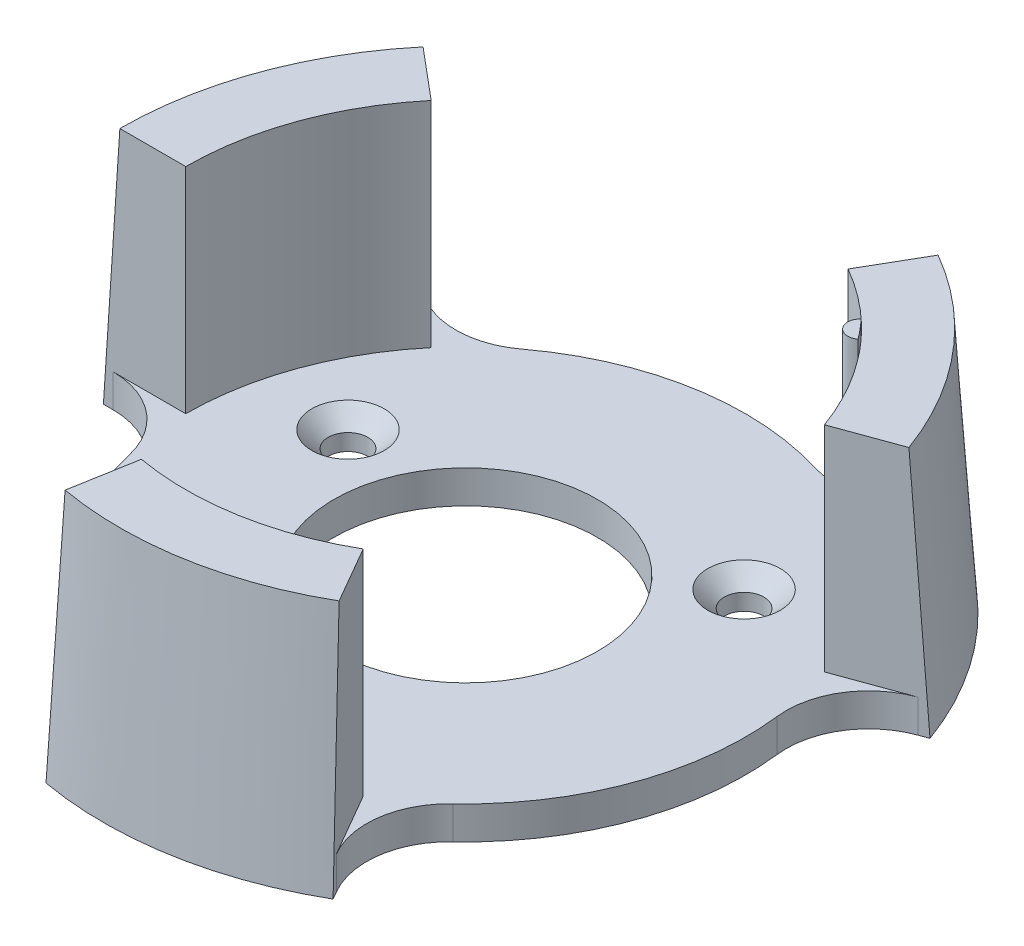
from build123d import *

# Parameters (mm, degrees)
SKETCH1_R                                    = 17
SKETCH1_R_2                                  = 8
BOSS_EXTRUDE4_DEPTH                          = 2
REVOLVE2_ANGLE                               = 40
CIRPATTERN1_COUNT                            = 3
FILLET1_R                                    = 5
CSK_FOR_M2_COUNTERSUNK_FLAT_HEAD_SCR_2_COUNT = 2
CSK_FOR_M2_COUNTERSUNK_FLAT_HEAD_SCR_2_PITCH = 20.784609691
CSK_FOR_M2_COUNTERSUNK_FLAT_HEAD_SCR_3_COUNT = 2
CSK_FOR_M2_COUNTERSUNK_FLAT_HEAD_SCR_3_PITCH = 20.747553677
BOSS_EXTRUDE6_DEPTH                          = 14


with BuildPart() as part:
    # Sketch1 → Boss-Extrude4 (new body)
    with BuildSketch(Plane(origin=(0, 0, 0), x_dir=(1, 0, 0), z_dir=(0, 1, 0))):
        Circle(SKETCH1_R)
        Circle(SKETCH1_R_2, mode=Mode.SUBTRACT)
    extrude(amount=BOSS_EXTRUDE4_DEPTH)

    # Sketch5 → Revolve2 (revolve)
    with BuildSketch(Plane.XY):
        Polygon((-17, 0), (-22, 0), (-21, 15), (-17, 15), align=None)
    revolve2 = revolve(axis=Axis((0, 9.813682869, 0), (0, -1, 0)), revolution_arc=REVOLVE2_ANGLE)

    # CirPattern1: Revolve2 ×3 about axis
    cirpattern1_axis = Axis((0, 2, 0), (0, 1, 0))
    for i in range(1, CIRPATTERN1_COUNT):
        add(revolve2.rotate(cirpattern1_axis, i * 360 / CIRPATTERN1_COUNT))

    # Fillet1
    fillet1_edges = [part.edges().sort_by_distance(p)[0] for p in [
        (8.5, 1, 14.722431864),
        (15.974774553, 1, -5.814342437),
        (8.5, 1, -14.722431864),
        (-13.022755533, 1, -10.927389365),
        (-17, 1, 0),
        (-2.95201902, 1, 16.741731801),
    ]]
    fillet(fillet1_edges, radius=FILLET1_R)

    # Sketch13 → CSK for M2 Countersunk Flat Head Screw1 (revolve, cut)
    with BuildSketch(Plane(origin=(2.083778132, 2, 11.817693036), x_dir=(0, 0, 1), z_dir=(1, 0, 0))):
        Polygon((0, 0), (0, 2), (1.2, 2), (1.2, 1), (2.2, 0), align=None)
    csk_for_m2_countersunk_flat_head_screw1 = revolve(axis=Axis((2.083778132, 8.35, 11.817693036), (0, -1, 0)), mode=Mode.SUBTRACT)

    # CSK for M2 Countersunk Flat Head Scr 2: CSK for M2 Countersunk Flat Head Screw1 ×2
    with Locations(*[Vector(0.3420201433256633, 0, -0.9396926207859104) * (i * CSK_FOR_M2_COUNTERSUNK_FLAT_HEAD_SCR_2_PITCH) for i in range(1, CSK_FOR_M2_COUNTERSUNK_FLAT_HEAD_SCR_2_COUNT)]):
        add(csk_for_m2_countersunk_flat_head_screw1, mode=Mode.SUBTRACT)

    # CSK for M2 Countersunk Flat Head Scr 3: CSK for M2 Countersunk Flat Head Screw1 ×2
    with Locations(*[Vector(-0.6419971087705412, 0, -0.7667070577021357) * (i * CSK_FOR_M2_COUNTERSUNK_FLAT_HEAD_SCR_3_PITCH) for i in range(1, CSK_FOR_M2_COUNTERSUNK_FLAT_HEAD_SCR_3_COUNT)]):
        add(csk_for_m2_countersunk_flat_head_screw1, mode=Mode.SUBTRACT)

    # Sketch24 → Boss-Extrude6 (add)
    with BuildSketch(Plane(origin=(0, 2, 0), x_dir=(1, 0, 0), z_dir=(0, 1, 0))):
        with BuildLine():
            ThreePointArc((12.528097784, 11.491160338), (12.448209945, 10.445288373), (13.492065142, 10.342348776))
            ThreePointArc((13.492065142, 10.342348776), (13.022755533, 10.927389365), (12.528097784, 11.491160338))
        make_face()
    extrude(amount=BOSS_EXTRUDE6_DEPTH)


solid = part.part
